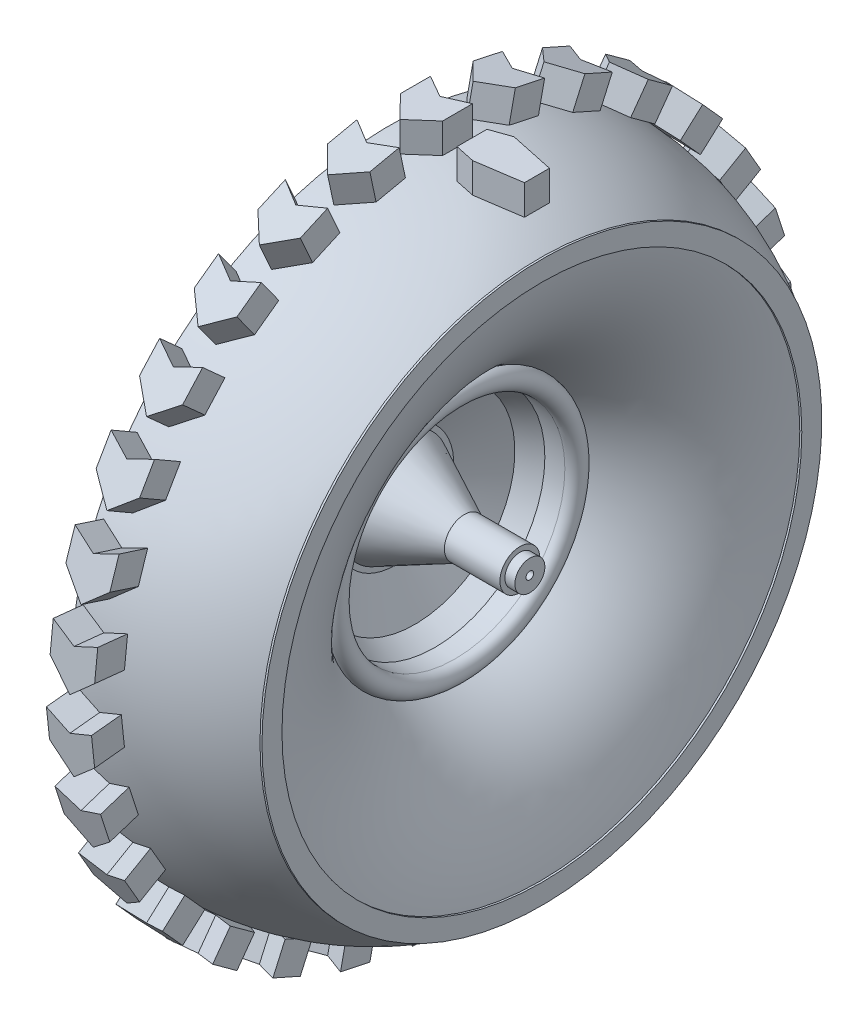
from build123d import *

# Parameters (mm, degrees)
Y_KSEKLIK_EKSTR_ZYON19_DEPTH = 3
DAIRESEL_START               = -35
DAIRESEL_KAPLAMA9_DEPTH      = 3
DAIRESEL_START_2             = 32
DAIRESEL_KAPLAMA9_2_DEPTH    = 3
DAIRESEL_KAPLAMA9_3_DEPTH    = 3
DAIRESEL_KAPLAMA9_4_DEPTH    = 3
DAIRESEL_KAPLAMA9_5_DEPTH    = 3
DAIRESEL_KAPLAMA9_6_DEPTH    = 3
DAIRESEL_KAPLAMA9_7_DEPTH    = 3
DAIRESEL_KAPLAMA9_8_DEPTH    = 3
DAIRESEL_KAPLAMA9_9_DEPTH    = 3
DAIRESEL_KAPLAMA9_10_DEPTH   = 3
DAIRESEL_KAPLAMA9_11_DEPTH   = 3
DAIRESEL_KAPLAMA9_12_DEPTH   = 3
DAIRESEL_KAPLAMA9_13_DEPTH   = 3
DAIRESEL_KAPLAMA9_14_DEPTH   = 3
DAIRESEL_KAPLAMA9_15_DEPTH   = 3
DAIRESEL_KAPLAMA9_16_DEPTH   = 3
DAIRESEL_KAPLAMA9_17_DEPTH   = 3
DAIRESEL_KAPLAMA9_18_DEPTH   = 3
DAIRESEL_KAPLAMA9_19_DEPTH   = 3
DAIRESEL_KAPLAMA9_20_DEPTH   = 3
DAIRESEL_KAPLAMA9_21_DEPTH   = 3
DAIRESEL_KAPLAMA9_22_DEPTH   = 3
DAIRESEL_KAPLAMA9_23_DEPTH   = 3
DAIRESEL_KAPLAMA9_24_DEPTH   = 3
DAIRESEL_KAPLAMA9_25_DEPTH   = 3
DAIRESEL_KAPLAMA9_26_DEPTH   = 3
DAIRESEL_KAPLAMA9_27_DEPTH   = 3
DAIRESEL_KAPLAMA9_28_DEPTH   = 3
DAIRESEL_KAPLAMA9_29_DEPTH   = 3


# Read off the part's stored shape, not the designer's step: Dairesel Kaplama9
with BuildPart() as part:
    # Çizim1 → Döndür18 (revolve)
    with BuildSketch(Plane(origin=(0, 0, 0), x_dir=(1, 0, 0), z_dir=(0, 1, 0)), mode=Mode.PRIVATE) as d_nd_r18_sk:
        with BuildLine():
            Line((25.129140063, 1.5), (25.129140063, 0.385937514))
            Line((25.129140063, 0.385937514), (29.129140063, 0.385937514))
            Line((29.129140063, 0.385937514), (29.129140063, 1.5))
            Line((29.129140063, 1.5), (28.129140063, 1.5))
            Line((28.129140063, 1.5), (28.129140063, 2))
            Line((28.129140063, 2), (22.575463274, 2))
            Line((22.575463274, 2), (15.629140063, 5.376041916))
            Line((15.629140063, 5.376041916), (15.629140063, 5.884930707))
            Line((15.629140063, 5.884930707), (17.629140063, 10))
            Line((17.629140063, 10), (19.629140063, 11))
            Line((19.629140063, 11), (21.629140063, 11))
            ThreePointArc((21.629140063, 11), (22.629140063, 12), (21.629140063, 13))
            Line((21.629140063, 13), (21.629140063, 12.5))
            ThreePointArc((21.629140063, 12.5), (22.129140063, 12), (21.629140063, 11.5))
            Line((21.629140063, 11.5), (19.511106074, 11.5))
            Line((19.511106074, 11.5), (17.253662302, 10.371278114))
            Line((17.253662302, 10.371278114), (15.129140063, 6))
            Line((15.129140063, 6), (15.129140063, 5.063125379))
            Line((15.129140063, 5.063125379), (22.460393981, 1.5))
            Line((22.460393981, 1.5), (25.129140063, 1.5))
        make_face()
    revolve(d_nd_r18_sk.sketch.rotate(Axis((-76.473476271, 0, 0), (1, 0, 0)), 180), axis=Axis((-76.473476271, 0, 0), (1, 0, 0)))

    # Çizim6 → Döndür19 (revolve)
    with BuildSketch(Plane(origin=(0, 0, 0), x_dir=(1, 0, 0), z_dir=(0, 1, 0)), mode=Mode.PRIVATE) as d_nd_r19_sk:
        with BuildLine():
            Line((30.129140063, 26), (30.329140063, 26))
            Line((30.329140063, 26), (30.329140063, 28))
            Line((30.329140063, 28), (30.129140063, 28))
            add(Edge.make_bspline(
                [(30.129140063, 28), (23.422676411, 32.333146916), (15.129140063, 32)],
                knots=[0, 0, 0, 1, 1, 1], degree=2))
            Line((15.129140063, 32), (15.169277158, 31.000805818))
            add(Edge.make_bspline(
                [(29.329140063, 27.324152542), (23.000835635, 31.313618261), (15.169277158, 31.000805818)],
                knots=[0.019887477, 0.019887477, 0.019887477, 1, 1, 1], degree=2))
            Line((29.329140063, 27.324152542), (29.329140063, 27))
            Line((29.329140063, 27), (29.27315608, 27))
            add(Edge.make_bspline(
                [(21.080432517, 13.836014371), (21.67065716, 14.223400912), (22.833668863, 15.06854665), (24.833893151, 16.868793626), (26.449315961, 18.896379835), (27.674136331, 21.150032705), (28.401597755, 22.956217766), (28.851455695, 24.574854152), (29.109324217, 25.908916994), (29.217217426, 26.641719951), (29.27315608, 27)],
                knots=[0, 0, 0, 0, 0.131392818, 0.262785636, 0.525571272, 0.65696409, 0.788356908, 0.919749726, 0.985446135, 1.051142544, 1.051142544, 1.051142544, 1.051142544], degree=3))
            Line((21.080432517, 13.836014371), (21.080432517, 12.128152103))
            Line((21.080432517, 12.128152103), (21.629140063, 12.128152103))
            Line((21.629140063, 12.128152103), (21.629140063, 13))
            add(Edge.make_bspline(
                [(21.629140063, 13), (26.435166677, 16.15437528), (29.26850001, 20.487708614), (30.129140063, 26)],
                knots=[0, 0, 0, 0, 1, 1, 1, 1], degree=3))
        make_face()
    revolve(d_nd_r19_sk.sketch.rotate(Axis((0, 0, 0), (1, 0, 0)), 180), axis=Axis((0, 0, 0), (1, 0, 0)))

    # Çizim23 → Yükseklik-Ekstrüzyon19 (add)
    with BuildSketch(Plane(origin=(0, 32, 0), x_dir=(1, 0, 0), z_dir=(0, 1, 0))):
        Polygon((23.336269391, 1.5), (23.336269391, -1.5), (25.336269391, -1.925662589), (29.836269391, -1.25), (29.836269391, 1.25), (25.336269391, 2.207740825), align=None)
        Polygon((15.916853876, 3.265000624), (18.130161742, 2), (20.398802306, 3), (20.398802306, 0), (18.130161742, -2), (15.916853876, 0.265000624), align=None)
    extrude(amount=Y_KSEKLIK_EKSTR_ZYON19_DEPTH)


with BuildPart() as y_kseklik_ekstr_zyon19_piece_1:
    # of the separate pieces the step leaves, piece 1, a body of its own (y_kseklik_ekstr_zyon19_pieces)
    add(part.part.solids().sort_by_distance((21.629140063, 0, 12.5))[0])

    # Dairesel Kaplama9 outline → Dairesel Kaplama9 (add)
    with BuildSketch(Plane(origin=(0, 0, 0), x_dir=(1, 0, 0), z_dir=(0, 0.9781476007338056, -0.20791169081775993)).offset(DAIRESEL_START)):
        Polygon((18.130161742, 2), (15.916853876, -0.265000624), (15.916853876, -3.265000624), (18.130161742, -2), (20.398802306, -3), (20.398802306, 0), align=None)
    extrude(amount=DAIRESEL_KAPLAMA9_DEPTH)

    # Dairesel Kaplama9 2 outline → Dairesel Kaplama9 2 (add)
    with BuildSketch(Plane(origin=(0, 0, 0), x_dir=(1, 0, 0), z_dir=(0, 0.9781476007338056, -0.20791169081775993)).offset(DAIRESEL_START_2)):
        Polygon((15.916853876, 3.265000624), (15.916853876, 0.265000624), (18.130161742, -2), (20.398802306, 0), (20.398802306, 3), (18.130161742, 2), align=None)
    extrude(amount=DAIRESEL_KAPLAMA9_2_DEPTH)

    # Dairesel Kaplama9 3 outline → Dairesel Kaplama9 3 (add)
    with BuildSketch(Plane(origin=(0, 0, 0), x_dir=(1, 0, 0), z_dir=(0, 0.9135454576426006, -0.4067366430758008)).offset(DAIRESEL_START)):
        Polygon((18.130161742, 2), (15.916853876, -0.265000624), (15.916853876, -3.265000624), (18.130161742, -2), (20.398802306, -3), (20.398802306, 0), align=None)
    extrude(amount=DAIRESEL_KAPLAMA9_3_DEPTH)

    # Dairesel Kaplama9 4 outline → Dairesel Kaplama9 4 (add)
    with BuildSketch(Plane(origin=(0, 0, 0), x_dir=(1, 0, 0), z_dir=(0, 0.9135454576426006, -0.4067366430758008)).offset(DAIRESEL_START_2)):
        Polygon((15.916853876, 3.265000624), (15.916853876, 0.265000624), (18.130161742, -2), (20.398802306, 0), (20.398802306, 3), (18.130161742, 2), align=None)
    extrude(amount=DAIRESEL_KAPLAMA9_4_DEPTH)

    # Dairesel Kaplama9 5 outline → Dairesel Kaplama9 5 (add)
    with BuildSketch(Plane(origin=(0, 0, 0), x_dir=(1, 0, 0), z_dir=(0, 0.8090169943749469, -0.587785252292474)).offset(DAIRESEL_START)):
        Polygon((18.130161742, 2), (15.916853876, -0.265000624), (15.916853876, -3.265000624), (18.130161742, -2), (20.398802306, -3), (20.398802306, 0), align=None)
    extrude(amount=DAIRESEL_KAPLAMA9_5_DEPTH)

    # Dairesel Kaplama9 6 outline → Dairesel Kaplama9 6 (add)
    with BuildSketch(Plane(origin=(0, 0, 0), x_dir=(1, 0, 0), z_dir=(0, 0.8090169943749469, -0.587785252292474)).offset(DAIRESEL_START_2)):
        Polygon((15.916853876, 3.265000624), (15.916853876, 0.265000624), (18.130161742, -2), (20.398802306, 0), (20.398802306, 3), (18.130161742, 2), align=None)
    extrude(amount=DAIRESEL_KAPLAMA9_6_DEPTH)

    # Dairesel Kaplama9 7 outline → Dairesel Kaplama9 7 (add)
    with BuildSketch(Plane(origin=(0, 0, 0), x_dir=(1, 0, 0), z_dir=(0, 0.6691306063588572, -0.7431448254773952)).offset(DAIRESEL_START)):
        Polygon((18.130161742, 2), (15.916853876, -0.265000624), (15.916853876, -3.265000624), (18.130161742, -2), (20.398802306, -3), (20.398802306, 0), align=None)
    extrude(amount=DAIRESEL_KAPLAMA9_7_DEPTH)

    # Dairesel Kaplama9 8 outline → Dairesel Kaplama9 8 (add)
    with BuildSketch(Plane(origin=(0, 0, 0), x_dir=(1, 0, 0), z_dir=(0, 0.6691306063588572, -0.7431448254773952)).offset(DAIRESEL_START_2)):
        Polygon((15.916853876, 3.265000624), (15.916853876, 0.265000624), (18.130161742, -2), (20.398802306, 0), (20.398802306, 3), (18.130161742, 2), align=None)
    extrude(amount=DAIRESEL_KAPLAMA9_8_DEPTH)

    # Dairesel Kaplama9 9 outline → Dairesel Kaplama9 9 (add)
    with BuildSketch(Plane(origin=(0, 0, 0), x_dir=(1, 0, 0), z_dir=(0, 0.49999999999999795, -0.8660254037844399)).offset(DAIRESEL_START)):
        Polygon((18.130161742, 2), (15.916853876, -0.265000624), (15.916853876, -3.265000624), (18.130161742, -2), (20.398802306, -3), (20.398802306, 0), align=None)
    extrude(amount=DAIRESEL_KAPLAMA9_9_DEPTH)

    # Dairesel Kaplama9 10 outline → Dairesel Kaplama9 10 (add)
    with BuildSketch(Plane(origin=(0, 0, 0), x_dir=(1, 0, 0), z_dir=(0, 0.49999999999999795, -0.8660254037844399)).offset(DAIRESEL_START_2)):
        Polygon((15.916853876, 3.265000624), (15.916853876, 0.265000624), (18.130161742, -2), (20.398802306, 0), (20.398802306, 3), (18.130161742, 2), align=None)
    extrude(amount=DAIRESEL_KAPLAMA9_10_DEPTH)

    # Dairesel Kaplama9 11 outline → Dairesel Kaplama9 11 (add)
    with BuildSketch(Plane(origin=(0, 0, 0), x_dir=(1, 0, 0), z_dir=(0, 0.3090169943749452, -0.9510565162951544)).offset(DAIRESEL_START)):
        Polygon((18.130161742, 2), (15.916853876, -0.265000624), (15.916853876, -3.265000624), (18.130161742, -2), (20.398802306, -3), (20.398802306, 0), align=None)
    extrude(amount=DAIRESEL_KAPLAMA9_11_DEPTH)

    # Dairesel Kaplama9 12 outline → Dairesel Kaplama9 12 (add)
    with BuildSketch(Plane(origin=(0, 0, 0), x_dir=(1, 0, 0), z_dir=(0, 0.3090169943749452, -0.9510565162951544)).offset(DAIRESEL_START_2)):
        Polygon((15.916853876, 3.265000624), (15.916853876, 0.265000624), (18.130161742, -2), (20.398802306, 0), (20.398802306, 3), (18.130161742, 2), align=None)
    extrude(amount=DAIRESEL_KAPLAMA9_12_DEPTH)

    # Dairesel Kaplama9 13 outline → Dairesel Kaplama9 13 (add)
    with BuildSketch(Plane(origin=(0, 0, 0), x_dir=(1, 0, 0), z_dir=(0, 0.10452846326764997, -0.9945218953682737)).offset(DAIRESEL_START)):
        Polygon((18.130161742, 2), (15.916853876, -0.265000624), (15.916853876, -3.265000624), (18.130161742, -2), (20.398802306, -3), (20.398802306, 0), align=None)
    extrude(amount=DAIRESEL_KAPLAMA9_13_DEPTH)

    # Dairesel Kaplama9 14 outline → Dairesel Kaplama9 14 (add)
    with BuildSketch(Plane(origin=(0, 0, 0), x_dir=(1, 0, 0), z_dir=(0, 0.10452846326764997, -0.9945218953682737)).offset(DAIRESEL_START_2)):
        Polygon((15.916853876, 3.265000624), (15.916853876, 0.265000624), (18.130161742, -2), (20.398802306, 0), (20.398802306, 3), (18.130161742, 2), align=None)
    extrude(amount=DAIRESEL_KAPLAMA9_14_DEPTH)

    # Dairesel Kaplama9 15 outline → Dairesel Kaplama9 15 (add)
    with BuildSketch(Plane(origin=(0, 0, 0), x_dir=(1, 0, 0), z_dir=(0, 0.104528463267657, 0.994521895368273)).offset(DAIRESEL_START)):
        Polygon((15.916853876, -0.265000624), (15.916853876, -3.265000624), (18.130161742, -2), (20.398802306, -3), (20.398802306, 0), (18.130161742, 2), align=None)
    extrude(amount=DAIRESEL_KAPLAMA9_15_DEPTH)

    # Dairesel Kaplama9 16 outline → Dairesel Kaplama9 16 (add)
    with BuildSketch(Plane(origin=(0, 0, 0), x_dir=(1, 0, 0), z_dir=(0, 0.104528463267657, 0.994521895368273)).offset(DAIRESEL_START_2)):
        Polygon((18.130161742, -2), (20.398802306, 0), (20.398802306, 3), (18.130161742, 2), (15.916853876, 3.265000624), (15.916853876, 0.265000624), align=None)
    extrude(amount=DAIRESEL_KAPLAMA9_16_DEPTH)

    # Dairesel Kaplama9 17 outline → Dairesel Kaplama9 17 (add)
    with BuildSketch(Plane(origin=(0, 0, 0), x_dir=(1, 0, 0), z_dir=(0, 0.3090169943749511, 0.9510565162951524)).offset(DAIRESEL_START)):
        Polygon((15.916853876, -0.265000624), (15.916853876, -3.265000624), (18.130161742, -2), (20.398802306, -3), (20.398802306, 0), (18.130161742, 2), align=None)
    extrude(amount=DAIRESEL_KAPLAMA9_17_DEPTH)

    # Dairesel Kaplama9 18 outline → Dairesel Kaplama9 18 (add)
    with BuildSketch(Plane(origin=(0, 0, 0), x_dir=(1, 0, 0), z_dir=(0, 0.3090169943749511, 0.9510565162951524)).offset(DAIRESEL_START_2)):
        Polygon((18.130161742, -2), (20.398802306, 0), (20.398802306, 3), (18.130161742, 2), (15.916853876, 3.265000624), (15.916853876, 0.265000624), align=None)
    extrude(amount=DAIRESEL_KAPLAMA9_18_DEPTH)

    # Dairesel Kaplama9 19 outline → Dairesel Kaplama9 19 (add)
    with BuildSketch(Plane(origin=(0, 0, 0), x_dir=(1, 0, 0), z_dir=(0, 0.5000000000000042, 0.8660254037844363)).offset(DAIRESEL_START)):
        Polygon((15.916853876, -0.265000624), (15.916853876, -3.265000624), (18.130161742, -2), (20.398802306, -3), (20.398802306, 0), (18.130161742, 2), align=None)
    extrude(amount=DAIRESEL_KAPLAMA9_19_DEPTH)

    # Dairesel Kaplama9 20 outline → Dairesel Kaplama9 20 (add)
    with BuildSketch(Plane(origin=(0, 0, 0), x_dir=(1, 0, 0), z_dir=(0, 0.5000000000000042, 0.8660254037844363)).offset(DAIRESEL_START_2)):
        Polygon((18.130161742, -2), (20.398802306, 0), (20.398802306, 3), (18.130161742, 2), (15.916853876, 3.265000624), (15.916853876, 0.265000624), align=None)
    extrude(amount=DAIRESEL_KAPLAMA9_20_DEPTH)

    # Dairesel Kaplama9 21 outline → Dairesel Kaplama9 21 (add)
    with BuildSketch(Plane(origin=(0, 0, 0), x_dir=(1, 0, 0), z_dir=(0, 0.6691306063588619, 0.7431448254773909)).offset(DAIRESEL_START)):
        Polygon((15.916853876, -0.265000624), (15.916853876, -3.265000624), (18.130161742, -2), (20.398802306, -3), (20.398802306, 0), (18.130161742, 2), align=None)
    extrude(amount=DAIRESEL_KAPLAMA9_21_DEPTH)

    # Dairesel Kaplama9 22 outline → Dairesel Kaplama9 22 (add)
    with BuildSketch(Plane(origin=(0, 0, 0), x_dir=(1, 0, 0), z_dir=(0, 0.6691306063588619, 0.7431448254773909)).offset(DAIRESEL_START_2)):
        Polygon((18.130161742, -2), (20.398802306, 0), (20.398802306, 3), (18.130161742, 2), (15.916853876, 3.265000624), (15.916853876, 0.265000624), align=None)
    extrude(amount=DAIRESEL_KAPLAMA9_22_DEPTH)

    # Dairesel Kaplama9 23 outline → Dairesel Kaplama9 23 (add)
    with BuildSketch(Plane(origin=(0, 0, 0), x_dir=(1, 0, 0), z_dir=(0, 0.8090169943749502, 0.5877852522924693)).offset(DAIRESEL_START)):
        Polygon((15.916853876, -0.265000624), (15.916853876, -3.265000624), (18.130161742, -2), (20.398802306, -3), (20.398802306, 0), (18.130161742, 2), align=None)
    extrude(amount=DAIRESEL_KAPLAMA9_23_DEPTH)

    # Dairesel Kaplama9 24 outline → Dairesel Kaplama9 24 (add)
    with BuildSketch(Plane(origin=(0, 0, 0), x_dir=(1, 0, 0), z_dir=(0, 0.8090169943749502, 0.5877852522924693)).offset(DAIRESEL_START_2)):
        Polygon((18.130161742, -2), (20.398802306, 0), (20.398802306, 3), (18.130161742, 2), (15.916853876, 3.265000624), (15.916853876, 0.265000624), align=None)
    extrude(amount=DAIRESEL_KAPLAMA9_24_DEPTH)

    # Dairesel Kaplama9 25 outline → Dairesel Kaplama9 25 (add)
    with BuildSketch(Plane(origin=(0, 0, 0), x_dir=(1, 0, 0), z_dir=(0, 0.9135454576426032, 0.4067366430757951)).offset(DAIRESEL_START)):
        Polygon((15.916853876, -0.265000624), (15.916853876, -3.265000624), (18.130161742, -2), (20.398802306, -3), (20.398802306, 0), (18.130161742, 2), align=None)
    extrude(amount=DAIRESEL_KAPLAMA9_25_DEPTH)

    # Dairesel Kaplama9 26 outline → Dairesel Kaplama9 26 (add)
    with BuildSketch(Plane(origin=(0, 0, 0), x_dir=(1, 0, 0), z_dir=(0, 0.9135454576426032, 0.4067366430757951)).offset(DAIRESEL_START_2)):
        Polygon((18.130161742, -2), (20.398802306, 0), (20.398802306, 3), (18.130161742, 2), (15.916853876, 3.265000624), (15.916853876, 0.265000624), align=None)
    extrude(amount=DAIRESEL_KAPLAMA9_26_DEPTH)

    # Dairesel Kaplama9 27 outline → Dairesel Kaplama9 27 (add)
    with BuildSketch(Plane(origin=(0, 0, 0), x_dir=(1, 0, 0), z_dir=(0, 0.978147600733807, 0.207911690817753)).offset(DAIRESEL_START)):
        Polygon((15.916853876, -0.265000624), (15.916853876, -3.265000624), (18.130161742, -2), (20.398802306, -3), (20.398802306, 0), (18.130161742, 2), align=None)
    extrude(amount=DAIRESEL_KAPLAMA9_27_DEPTH)

    # Dairesel Kaplama9 28 outline → Dairesel Kaplama9 28 (add)
    with BuildSketch(Plane(origin=(0, 0, 0), x_dir=(1, 0, 0), z_dir=(0, 0.978147600733807, 0.207911690817753)).offset(DAIRESEL_START_2)):
        Polygon((18.130161742, -2), (20.398802306, 0), (20.398802306, 3), (18.130161742, 2), (15.916853876, 3.265000624), (15.916853876, 0.265000624), align=None)
    extrude(amount=DAIRESEL_KAPLAMA9_28_DEPTH)

    # Dairesel Kaplama9 29 outline → Dairesel Kaplama9 29 (add)
    with BuildSketch(Plane(origin=(0, 0, 0), x_dir=(1, 0, 0), z_dir=(0, 1, 0)).offset(DAIRESEL_START)):
        Polygon((15.916853876, -0.265000624), (15.916853876, -3.265000624), (18.130161742, -2), (20.398802306, -3), (20.398802306, 0), (18.130161742, 2), align=None)
    extrude(amount=DAIRESEL_KAPLAMA9_29_DEPTH)


with BuildPart() as y_kseklik_ekstr_zyon19_piece_2:
    # of the separate pieces the step leaves, piece 2, a body of its own (y_kseklik_ekstr_zyon19_pieces)
    add(part.part.solids().sort_by_distance((23.336269391, 32, -1.5))[0])


solid = Compound([y_kseklik_ekstr_zyon19_piece_1.part, y_kseklik_ekstr_zyon19_piece_2.part])
